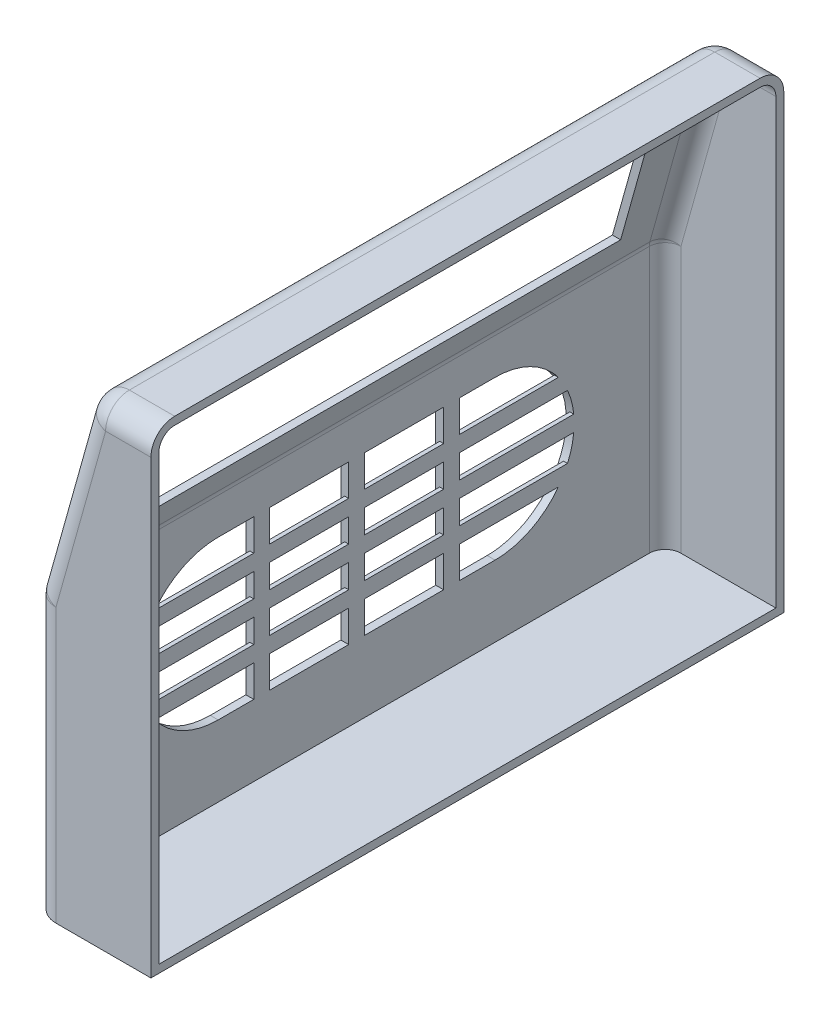
from build123d import *

# Parameters (mm, degrees)
BOSS_EXTRUDE1_DEPTH = 40
FILLET1_R           = 3
SHELL1_T            = -1
SKETCH2_W           = 65
SKETCH2_H           = 15
CUT_EXTRUDE1_DEPTH  = 53.201532545
VENT1_START         = -12.137690598
VENT1_OUTLINE_W     = 4
VENT1_OUTLINE_H     = 10
VENT1_OUTLINE_W_2   = 3
VENT1_DEPTH         = 1
VENT1_2_OUTLINE_W   = 2
VENT1_2_OUTLINE_H   = 10
VENT1_2_DEPTH       = 0.5


# Read off the part's stored shape, not the designer's step: Vent1
with BuildPart() as part:
    # Sketch1 → Boss-Extrude1 (new, symmetric)
    with BuildSketch(Plane.XY):
        with BuildLine():
            Line((-5.751201461, 27.808889777), (-12.137690598, 5))
            Line((-12.137690598, 5), (-12.137690598, -30))
            Line((-12.137690598, -30), (2.862309402, -30))
            Line((2.862309402, -30), (2.862309402, 30))
            Line((2.862309402, 30), (-2.862309402, 30))
            ThreePointArc((-2.862309402, 30), (-4.675225653, 29.390258284), (-5.751201461, 27.808889777))
        make_face()
    extrude(amount=BOSS_EXTRUDE1_DEPTH, both=True)

    # Fillet1
    fillet1_edges = [part.edges().sort_by_distance(p)[0] for p in [
        (-12.137690598, 5, 0),
        (-4.675225653, 29.390258284, 40),
        (-8.94444603, 16.404444888, 40),
        (-12.137690598, -12.5, 40),
        (-12.137690598, -12.5, -40),
        (-8.94444603, 16.404444888, -40),
        (-4.675225653, 29.390258284, -40),
        (0, 30, -40),
        (0, 30, 40),
    ]]
    fillet(fillet1_edges, radius=FILLET1_R)

    # Shell1
    shell1_openings = [part.faces().sort_by_distance(p)[0] for p in [
        (2.862309402, -0.023622446, 0),
    ]]
    offset(amount=SHELL1_T, openings=shell1_openings, kind=Kind.INTERSECTION)

    # Sketch2 → Cut-Extrude1 (cut, through all)
    with BuildSketch(Plane.ZY.offset(12.137690598)):
        with Locations((0, 15.5)):
            Rectangle(SKETCH2_W, SKETCH2_H)
    extrude(amount=-CUT_EXTRUDE1_DEPTH, mode=Mode.SUBTRACT)

    # Vent1 outline → Vent1 (cut)
    with BuildSketch(Plane.YZ.offset(VENT1_START)):
        with BuildLine():
            add(Edge.make_bspline(
                [(-20, 17.5), (-20, 18.484636289), (-19.807852804, 19.45090322), (-19.615866008, 20.416363534), (-19.238795325, 21.326834324), (-18.862145538, 22.236288823), (-18.314696123, 23.05570233), (-17.767857785, 23.874201188), (-17.071067812, 24.571067812), (-16.567779985, 25.074411003), (-16, 25.500081295)],
                knots=[0, 0, 0, 0.0625, 0.0625, 0.125, 0.125, 0.1875, 0.1875, 0.25, 0.25, 0.295193876, 0.295193876, 0.295193876], degree=2))
            Line((-20, 17.5), (-20, 13))
            Line((-20, 13), (-16, 13))
            Line((-16, 13), (-16, 25.500081295))
        make_face()
        with BuildLine():
            add(Edge.make_bspline(
                [(-14, 26.665158313), (-13.9138372, 26.702751948), (-13.826834324, 26.738795325), (-12.917421262, 27.11554515), (-11.95090322, 27.307852804), (-11.477855415, 27.40197491), (-11, 27.449991893)],
                knots=[0.369027345, 0.369027345, 0.369027345, 0.375, 0.375, 0.4375, 0.4375, 0.468123874, 0.468123874, 0.468123874], degree=2))
            Line((-14, 26.665158313), (-14, 13))
            Line((-14, 13), (-11, 13))
            Line((-11, 13), (-11, 27.449991893))
        make_face()
        with BuildLine():
            add(Edge.make_bspline(
                [(-9, 27.449990782), (-8.522411136, 27.401973821), (-8.04909678, 27.307852804), (-7.083636466, 27.115866008), (-6.173165676, 26.738795325), (-6.086170897, 26.702766513), (-6, 26.665174873)],
                knots=[0.531893743, 0.531893743, 0.531893743, 0.5625, 0.5625, 0.625, 0.625, 0.6309785, 0.6309785, 0.6309785], degree=2))
            Line((-9, 27.449990782), (-9, 13))
            Line((-9, 13), (-6, 13))
            Line((-6, 13), (-6, 26.665174873))
        make_face()
        with BuildLine():
            add(Edge.make_bspline(
                [(-4, 25.500105578), (-3.432685944, 25.074766157), (-2.928932188, 24.571067812), (-2.232843424, 23.875055613), (-1.685303877, 23.05570233), (-1.138375507, 22.23726363), (-0.761204675, 21.326834324), (-0.38445485, 20.417421262), (-0.192147196, 19.45090322), (0, 18.485191624), (0, 17.5)],
                knots=[0.704819748, 0.704819748, 0.704819748, 0.75, 0.75, 0.8125, 0.8125, 0.875, 0.875, 0.9375, 0.9375, 1, 1, 1], degree=2))
            Line((-4, 25.500105578), (-4, 13))
            Line((-4, 13), (0, 13))
            Line((0, 13), (0, 17.5))
        make_face()
        with BuildLine():
            add(Edge.make_bspline(
                [(0, -17.5), (0, -18.484636289), (-0.192147196, -19.45090322), (-0.384133992, -20.416363534), (-0.761204675, -21.326834324), (-1.137854462, -22.236288823), (-1.685303877, -23.05570233), (-2.232142215, -23.874201188), (-2.928932188, -24.571067812), (-3.432220015, -25.074411003), (-4, -25.500081295)],
                knots=[0, 0, 0, 0.0625, 0.0625, 0.125, 0.125, 0.1875, 0.1875, 0.25, 0.25, 0.295193876, 0.295193876, 0.295193876], degree=2))
            Line((0, -17.5), (0, -13))
            Line((0, -13), (-4, -13))
            Line((-4, -13), (-4, -25.500081295))
        make_face()
        with BuildLine():
            add(Edge.make_bspline(
                [(-6, -26.665158313), (-6.086162801, -26.702751948), (-6.173165676, -26.738795325), (-7.082578738, -27.11554515), (-8.04909678, -27.307852804), (-8.522144585, -27.40197491), (-9, -27.449991893)],
                knots=[0.369027345, 0.369027345, 0.369027345, 0.375, 0.375, 0.4375, 0.4375, 0.468123874, 0.468123874, 0.468123874], degree=2))
            Line((-6, -26.665158313), (-6, -13))
            Line((-6, -13), (-9, -13))
            Line((-9, -13), (-9, -27.449991893))
        make_face()
        with BuildLine():
            add(Edge.make_bspline(
                [(-11, -27.449990782), (-11.477588864, -27.401973821), (-11.95090322, -27.307852804), (-12.916363534, -27.115866008), (-13.826834324, -26.738795325), (-13.913829103, -26.702766513), (-14, -26.665174873)],
                knots=[0.531893743, 0.531893743, 0.531893743, 0.5625, 0.5625, 0.625, 0.625, 0.6309785, 0.6309785, 0.6309785], degree=2))
            Line((-11, -27.449990782), (-11, -13))
            Line((-11, -13), (-14, -13))
            Line((-14, -13), (-14, -26.665174873))
        make_face()
        with BuildLine():
            add(Edge.make_bspline(
                [(-16, -25.500105578), (-16.567314056, -25.074766157), (-17.071067812, -24.571067812), (-17.767156576, -23.875055613), (-18.314696123, -23.05570233), (-18.861624493, -22.23726363), (-19.238795325, -21.326834324), (-19.61554515, -20.417421262), (-19.807852804, -19.45090322), (-20, -18.485191624), (-20, -17.5)],
                knots=[0.704819748, 0.704819748, 0.704819748, 0.75, 0.75, 0.8125, 0.8125, 0.875, 0.875, 0.9375, 0.9375, 1, 1, 1], degree=2))
            Line((-16, -25.500105578), (-16, -13))
            Line((-16, -13), (-20, -13))
            Line((-20, -13), (-20, -17.5))
        make_face()
        with Locations((-2, -6)):
            Rectangle(VENT1_OUTLINE_W, VENT1_OUTLINE_H)
        with Locations((-7.5, -6)):
            Rectangle(VENT1_OUTLINE_W_2, VENT1_OUTLINE_H)
        with Locations((-12.5, -6)):
            Rectangle(VENT1_OUTLINE_W_2, VENT1_OUTLINE_H)
        with Locations((-18, -6)):
            Rectangle(VENT1_OUTLINE_W, VENT1_OUTLINE_H)
        with Locations((-2, 6)):
            Rectangle(VENT1_OUTLINE_W, VENT1_OUTLINE_H)
        with Locations((-7.5, 6)):
            Rectangle(VENT1_OUTLINE_W_2, VENT1_OUTLINE_H)
        with Locations((-12.5, 6)):
            Rectangle(VENT1_OUTLINE_W_2, VENT1_OUTLINE_H)
        with Locations((-18, 6)):
            Rectangle(VENT1_OUTLINE_W, VENT1_OUTLINE_H)
    extrude(amount=VENT1_DEPTH, mode=Mode.SUBTRACT)

    # Vent1 2 outline → Vent1 2 (cut)
    with BuildSketch(Plane.YZ.offset(VENT1_START)):
        with BuildLine():
            add(Edge.make_bspline(
                [(-16, 25.500081295), (-15.782579599, 25.663083528), (-15.55570233, 25.814696123), (-14.815475656, 26.309358665), (-14, 26.665158313)],
                knots=[0.295193876, 0.295193876, 0.295193876, 0.3125, 0.3125, 0.369027345, 0.369027345, 0.369027345], degree=2))
            Line((-16, 25.500081295), (-16, 13))
            Line((-16, 13), (-14, 13))
            Line((-14, 13), (-14, 26.665158313))
        make_face()
        with BuildLine():
            add(Edge.make_bspline(
                [(-11, 27.449991893), (-10.502604415, 27.499972357), (-10, 27.5), (-9.497679153, 27.500027628), (-9, 27.449990782)],
                knots=[0.468123874, 0.468123874, 0.468123874, 0.5, 0.5, 0.531893743, 0.531893743, 0.531893743], degree=2))
            Line((-11, 27.449991893), (-11, 13))
            Line((-11, 13), (-9, 13))
            Line((-9, 13), (-9, 27.449990782))
        make_face()
        with BuildLine():
            add(Edge.make_bspline(
                [(-6, 26.665174873), (-5.18532936, 26.309778717), (-4.44429767, 25.814696123), (-4.217478567, 25.663158488), (-4, 25.500105578)],
                knots=[0.6309785, 0.6309785, 0.6309785, 0.6875, 0.6875, 0.704819748, 0.704819748, 0.704819748], degree=2))
            Line((-6, 26.665174873), (-6, 13))
            Line((-6, 13), (-4, 13))
            Line((-4, 13), (-4, 25.500105578))
        make_face()
        with BuildLine():
            add(Edge.make_bspline(
                [(-4, -25.500081295), (-4.217420401, -25.663083528), (-4.44429767, -25.814696123), (-5.184524344, -26.309358665), (-6, -26.665158313)],
                knots=[0.295193876, 0.295193876, 0.295193876, 0.3125, 0.3125, 0.369027345, 0.369027345, 0.369027345], degree=2))
            Line((-4, -25.500081295), (-4, -13))
            Line((-4, -13), (-6, -13))
            Line((-6, -13), (-6, -26.665158313))
        make_face()
        with BuildLine():
            add(Edge.make_bspline(
                [(-9, -27.449991893), (-9.497395585, -27.499972357), (-10, -27.5), (-10.502320847, -27.500027628), (-11, -27.449990782)],
                knots=[0.468123874, 0.468123874, 0.468123874, 0.5, 0.5, 0.531893743, 0.531893743, 0.531893743], degree=2))
            Line((-9, -27.449991893), (-9, -13))
            Line((-9, -13), (-11, -13))
            Line((-11, -13), (-11, -27.449990782))
        make_face()
        with BuildLine():
            add(Edge.make_bspline(
                [(-14, -26.665174873), (-14.81467064, -26.309778717), (-15.55570233, -25.814696123), (-15.782521433, -25.663158488), (-16, -25.500105578)],
                knots=[0.6309785, 0.6309785, 0.6309785, 0.6875, 0.6875, 0.704819748, 0.704819748, 0.704819748], degree=2))
            Line((-14, -26.665174873), (-14, -13))
            Line((-14, -13), (-16, -13))
            Line((-16, -13), (-16, -25.500105578))
        make_face()
        with Locations((-5, -6)):
            Rectangle(VENT1_2_OUTLINE_W, VENT1_2_OUTLINE_H)
        with Locations((-10, -6)):
            Rectangle(VENT1_2_OUTLINE_W, VENT1_2_OUTLINE_H)
        with Locations((-15, -6)):
            Rectangle(VENT1_2_OUTLINE_W, VENT1_2_OUTLINE_H)
        with Locations((-5, 6)):
            Rectangle(VENT1_2_OUTLINE_W, VENT1_2_OUTLINE_H)
        with Locations((-10, 6)):
            Rectangle(VENT1_2_OUTLINE_W, VENT1_2_OUTLINE_H)
        with Locations((-15, 6)):
            Rectangle(VENT1_2_OUTLINE_W, VENT1_2_OUTLINE_H)
    extrude(amount=VENT1_2_DEPTH, mode=Mode.SUBTRACT)


solid = part.part
